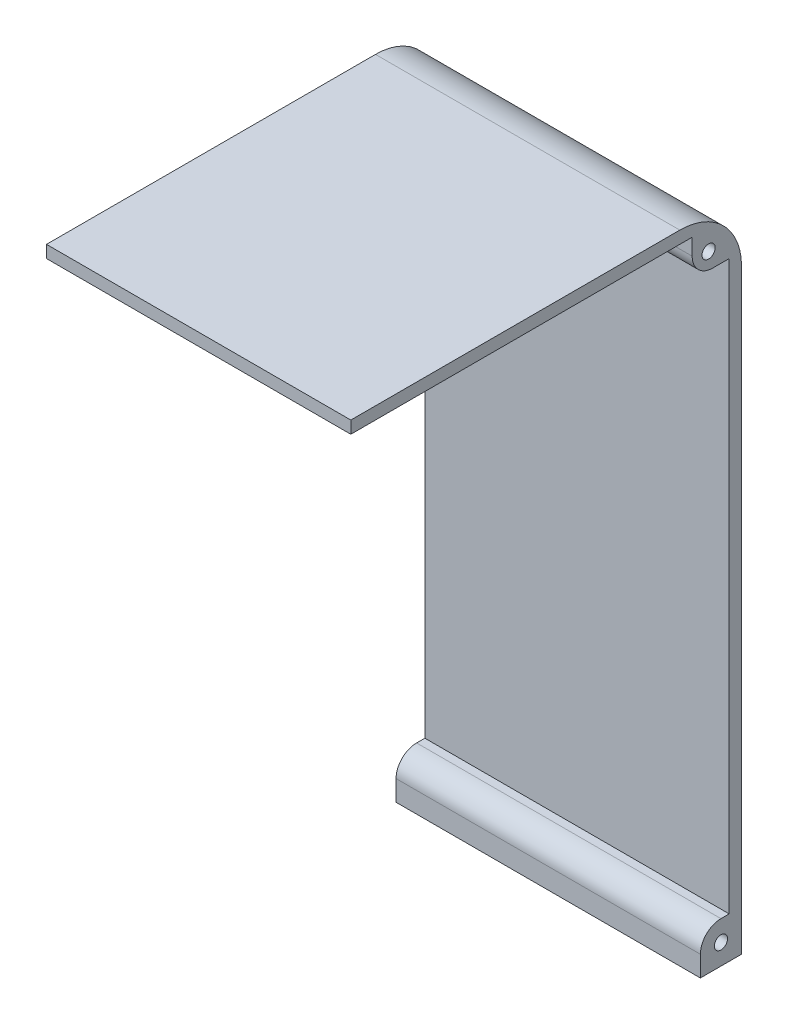
from build123d import *

# Parameters (mm, degrees)
SKETCH1_R           = 1.6
BOSS_EXTRUDE1_DEPTH = 74
FILLET1_R           = 15
FILLET2_R           = 5
FILLET3_R           = 5


with BuildPart() as part:
    # Sketch1 → Boss-Extrude1 (new body)
    with BuildSketch(Plane(origin=(0, 0, 0), x_dir=(0, 0, -1), z_dir=(1, 0, 0))):
        Polygon((10, 0), (10, 160), (-85, 160), (-85, 157), (-2, 157), (-2, 148), (7, 148), (7, 10), (0, 10), (0, 0), align=None)
        with Locations((2, 152)):
            Circle(SKETCH1_R, mode=Mode.SUBTRACT)
        with Locations((5, 5)):
            Circle(SKETCH1_R, mode=Mode.SUBTRACT)
    extrude(amount=BOSS_EXTRUDE1_DEPTH)

    # Fillet1
    fillet1_edges = [part.edges().sort_by_distance(p)[0] for p in [
        (37, 160, -10),
    ]]
    fillet(fillet1_edges, radius=FILLET1_R)

    # Fillet2
    fillet2_edges = [part.edges().sort_by_distance(p)[0] for p in [
        (37, 10, 0),
    ]]
    fillet(fillet2_edges, radius=FILLET2_R)

    # Fillet3
    fillet3_edges = [part.edges().sort_by_distance(p)[0] for p in [
        (37, 148, 2),
    ]]
    fillet(fillet3_edges, radius=FILLET3_R)


solid = part.part
